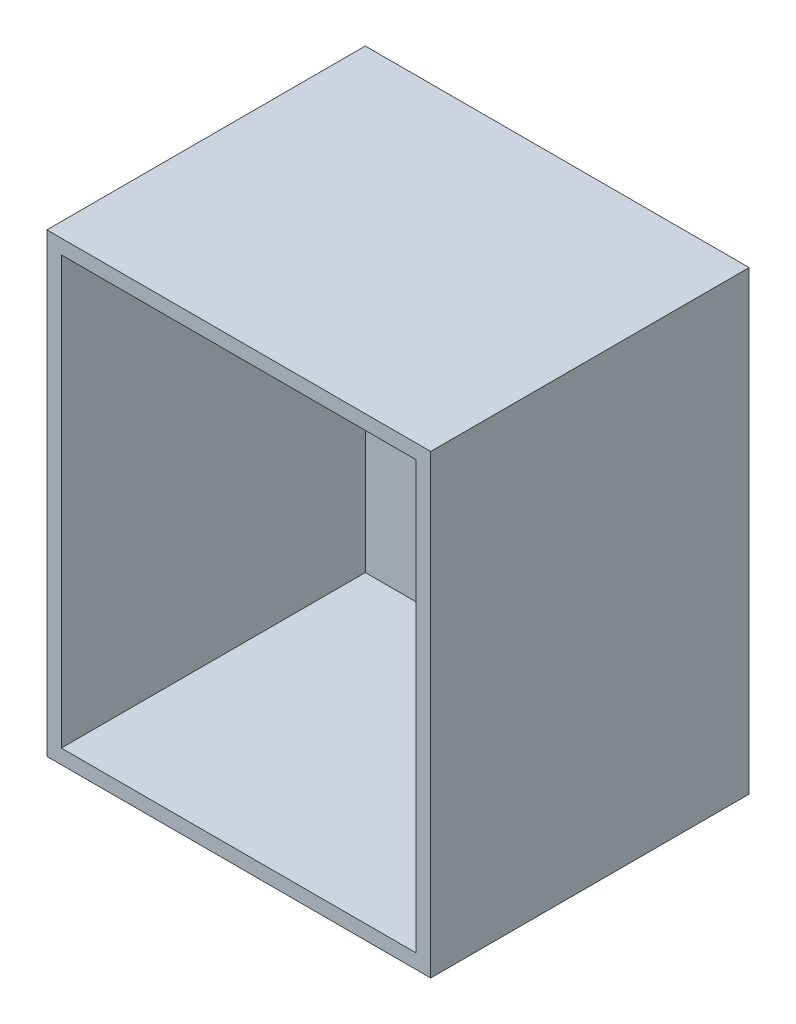
from build123d import *

# Parameters (mm, degrees)
SCHIZZO1_W                   = 50.5
SCHIZZO1_H                   = 60
ESTRUSIONE_ESTRUSIONE1_DEPTH = 1.9
SCHIZZO2_W                   = 1.9
SCHIZZO2_H                   = 60
ESTRUSIONE_ESTRUSIONE2_DEPTH = 40
SCHIZZO3_W                   = 48.6
SCHIZZO3_H                   = 1.9
ESTRUSIONE_ESTRUSIONE3_DEPTH = 40
SCHIZZO4_W                   = 1.9
SCHIZZO4_H                   = 58.1
ESTRUSIONE_ESTRUSIONE4_DEPTH = 40
SCHIZZO5_W                   = 46.7
SCHIZZO5_H                   = 1.9
ESTRUSIONE_ESTRUSIONE5_DEPTH = 40


with BuildPart() as part:
    # Schizzo1 → Estrusione-Estrusione1 (new body)
    with BuildSketch(Plane.XY):
        with Locations((25.25, 30)):
            Rectangle(SCHIZZO1_W, SCHIZZO1_H)
    extrude(amount=ESTRUSIONE_ESTRUSIONE1_DEPTH)

    # Schizzo2 → Estrusione-Estrusione2 (add)
    with BuildSketch(Plane.XY.offset(1.9)):
        with Locations((0.95, 30)):
            Rectangle(SCHIZZO2_W, SCHIZZO2_H)
    extrude(amount=ESTRUSIONE_ESTRUSIONE2_DEPTH)

    # Schizzo3 → Estrusione-Estrusione3 (add)
    with BuildSketch(Plane.XY.offset(1.9)):
        with Locations((26.2, 0.95)):
            Rectangle(SCHIZZO3_W, SCHIZZO3_H)
    extrude(amount=ESTRUSIONE_ESTRUSIONE3_DEPTH)

    # Schizzo4 → Estrusione-Estrusione4 (add)
    with BuildSketch(Plane.XY.offset(1.9)):
        with Locations((49.55, 30.95)):
            Rectangle(SCHIZZO4_W, SCHIZZO4_H)
    extrude(amount=ESTRUSIONE_ESTRUSIONE4_DEPTH)

    # Schizzo5 → Estrusione-Estrusione5 (add)
    with BuildSketch(Plane.XY.offset(1.9)):
        with Locations((25.25, 59.05)):
            Rectangle(SCHIZZO5_W, SCHIZZO5_H)
    extrude(amount=ESTRUSIONE_ESTRUSIONE5_DEPTH)


solid = part.part
